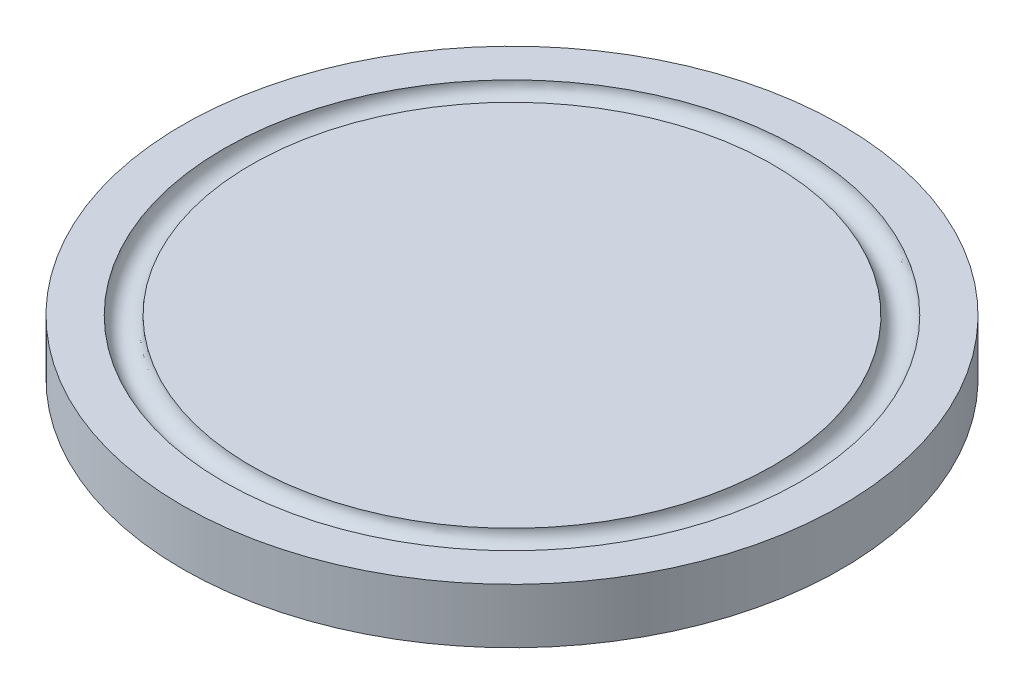
from build123d import *

# Parameters (mm, degrees)
SKETCH1_R           = 60
BOSS_EXTRUDE1_DEPTH = 10
SKETCH3_R           = 2.5


with BuildPart() as part:
    # Sketch1 → Boss-Extrude1 (new body)
    with BuildSketch(Plane(origin=(0, 0, 0), x_dir=(1, 0, 0), z_dir=(0, 1, 0))):
        Circle(SKETCH1_R)
    extrude(amount=BOSS_EXTRUDE1_DEPTH)

    # Cut-Sweep1: sweep along a path in Sketch2
    with BuildLine(Plane(origin=(0, 10, 0), x_dir=(1, 0, 0), z_dir=(0, 1, 0))) as cut_sweep1_path:
        CenterArc((0, 0), 50, 0, 360)
    # Sketch3 → Cut-Sweep1 (sweep, cut)
    with BuildSketch(Plane.XY):
        with Locations((50, 10)):
            Circle(SKETCH3_R)
    sweep(path=cut_sweep1_path.line, mode=Mode.SUBTRACT)


solid = part.part
